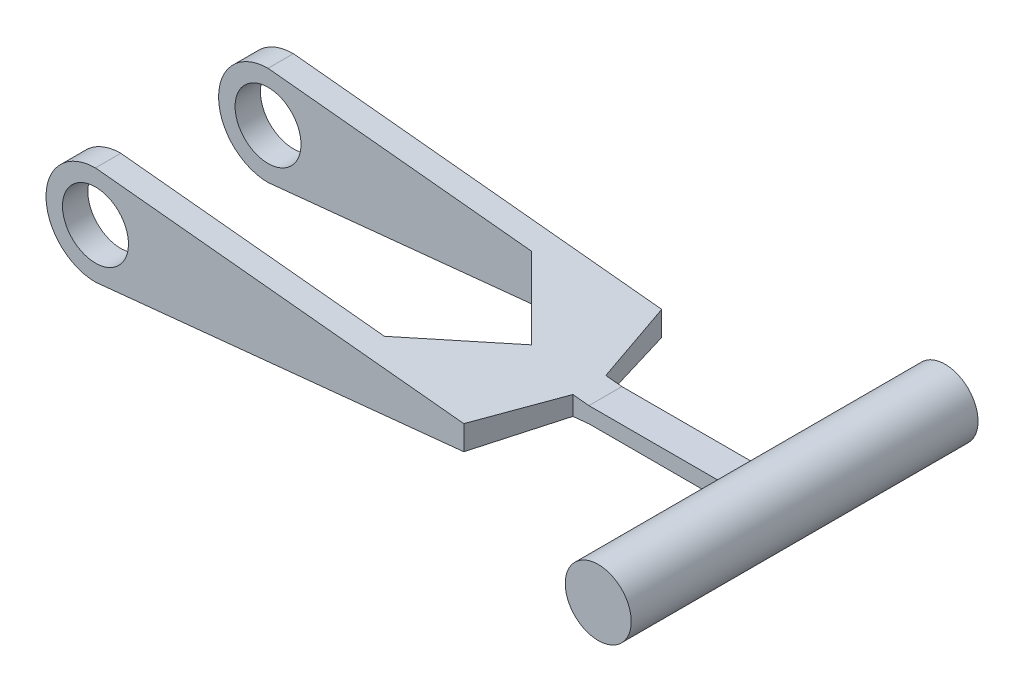
from build123d import *

# Parameters (mm, degrees)
SKETCH1_R           = 10
BOSS_EXTRUDE1_DEPTH = 60
SKETCH2_OUTSIDE_W   = 244.19
SKETCH2_OUTSIDE_H   = 104.19
CUT_EXTRUDE1_DEPTH  = 20
SKETCH3_R           = 10
BOSS_EXTRUDE2_DEPTH = 26.2874406
BOSS_EXTRUDE3_START = 26.2874406
SKETCH4_R           = 10
BOSS_EXTRUDE3_DEPTH = 26.2874406


with BuildPart() as part:
    # Sketch1 → Boss-Extrude1 (new body)
    with BuildSketch(Plane.XY):
        with BuildLine():
            ThreePointArc((-85, 15), (-100, 0), (-85, -15))
            Line((-85, -15), (39.599219547, -2.384625528))
            Line((39.599219547, -2.384625528), (80.215221564, -2.384625528))
            ThreePointArc((80.215221564, -2.384625528), (99.994531838, -0.651762376), (80.373005951, 2.384625528))
            Line((80.373005951, 2.384625528), (39.599219547, 2.384625528))
            Line((39.599219547, 2.384625528), (-85, 15))
        make_face()
        with Locations((-85, 0)):
            Circle(SKETCH1_R, mode=Mode.SUBTRACT)
    extrude(amount=BOSS_EXTRUDE1_DEPTH)

    # Sketch2 outside → Cut-Extrude1 (cut, symmetric)
    with BuildSketch(Plane(origin=(0, 2.384625528, 0), x_dir=(1, 0, 0), z_dir=(0, 1, 0))):
        with Locations((0, -30)):
            Rectangle(SKETCH2_OUTSIDE_W, SKETCH2_OUTSIDE_H)
        Polygon((34.734743134, -25), (26.666623154, 0), (-100, 0), (-100, -7.68377667), (-5.086975799, -7.68377667), (17.229247531, -30), (-5.086975799, -52.31622333), (-100, -52.31622333), (-100, -60), (26.666623154, -60), (34.734743134, -35), (80.373005951, -35), (80.373005951, -56.2874406), (100, -56.2874406), (100, -3.7125594), (80.373005951, -3.7125594), (80.373005951, -25), align=None, mode=Mode.SUBTRACT)
    extrude(amount=CUT_EXTRUDE1_DEPTH, both=True, mode=Mode.SUBTRACT)

    # Sketch3 → Boss-Extrude2 (add)
    with BuildSketch(Plane.XY.offset(56.2874406)):
        with Locations((90, -0.321106458)):
            Circle(SKETCH3_R)
    extrude(amount=BOSS_EXTRUDE2_DEPTH)

    # Sketch4 → Boss-Extrude3 (add)
    with BuildSketch(Plane(origin=(0, 0, 3.7125594), x_dir=(-1, 0, 0), z_dir=(0, 0, -1)).offset(BOSS_EXTRUDE3_START)):
        with Locations((-90, -0.321106458)):
            Circle(SKETCH4_R)
    extrude(amount=-BOSS_EXTRUDE3_DEPTH)


solid = part.part
